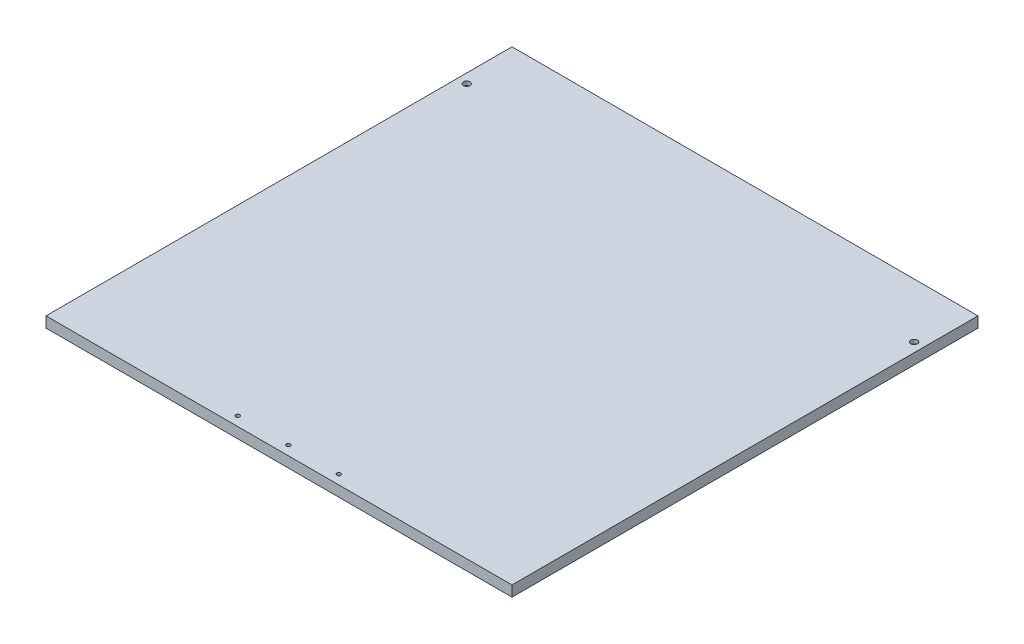
from build123d import *

# Parameters (mm, degrees)
PLATESKETCH2_W         = 350
PLATESKETCH2_H         = 350
PLATESKETCH2_R         = 1.5
BOSS_EXTRUDE1_DEPTH    = 8
BORESKETCH1_R          = 2.5
BORECUT_EXTRUDE1_DEPTH = 3


with BuildPart() as part:
    # PlateSketch2 → Boss-Extrude1 (new body)
    with BuildSketch(Plane(origin=(0, 0, 0), x_dir=(1, 0, 0), z_dir=(0, 1, 0))):
        with Locations((175, 175)):
            Rectangle(PLATESKETCH2_W, PLATESKETCH2_H)
        with Locations((7, 309)):
            Circle(PLATESKETCH2_R, mode=Mode.SUBTRACT)
        with Locations((343, 309)):
            Circle(PLATESKETCH2_R, mode=Mode.SUBTRACT)
        with Locations((137, 7)):
            Circle(PLATESKETCH2_R, mode=Mode.SUBTRACT)
        with Locations((175, 7)):
            Circle(PLATESKETCH2_R, mode=Mode.SUBTRACT)
        with Locations((213, 7)):
            Circle(PLATESKETCH2_R, mode=Mode.SUBTRACT)
    extrude(amount=BOSS_EXTRUDE1_DEPTH)

    # BoreSketch1 → BoreCut-Extrude1 (cut)
    with BuildSketch(Plane(origin=(0, 8, 0), x_dir=(1, 0, 0), z_dir=(0, 1, 0))):
        with Locations((7, 309)):
            Circle(BORESKETCH1_R)
        with Locations((343, 309)):
            Circle(BORESKETCH1_R)
    extrude(amount=-BORECUT_EXTRUDE1_DEPTH, mode=Mode.SUBTRACT)


solid = part.part
